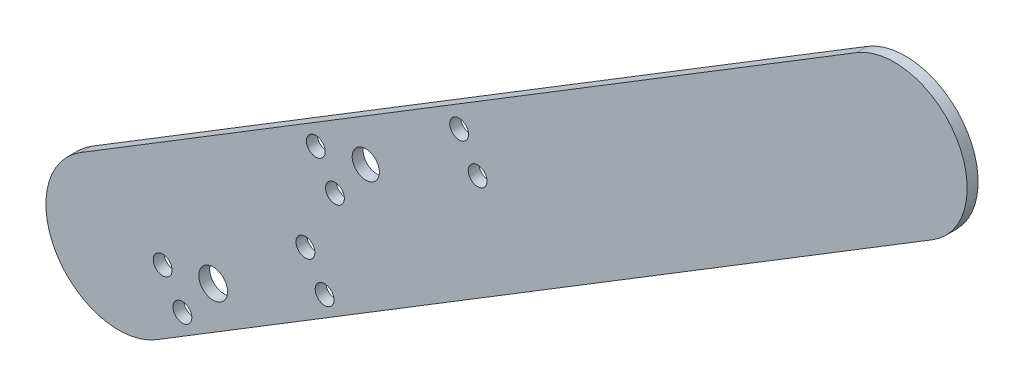
from build123d import *

# Parameters (mm, degrees)
BASE_FLANGE3_DEPTH         = 3
SKETCH2_R                  = 3.731705756
CUT_EXTRUDE1_DEPTH         = 10
F_6_0_204_DIAMETER_SLOT2_D = 5.1816
F_6_0_204_DIAMETER_SLOT3_D = 5.1816
F_6_0_204_DIAMETER_SLOT4_D = 5.1816
SKETCH11_R                 = 3.962302528
CUT_EXTRUDE2_DEPTH         = 10


# Sheet-metal steps are written as plain solids
with BuildPart() as part:
    # Sketch1 → Base-Flange3 (new body)
    with BuildSketch(Plane.XY):
        with BuildLine():
            Line((-47.22804279, 44.626403811), (166.055568315, 175.049182627))
            ThreePointArc((166.055568315, 175.049182627), (193.552079509, 168.420316044), (186.923212926, 140.923804851))
            Line((186.923212926, 140.923804851), (-26.360398179, 10.501026034))
            ThreePointArc((-26.360398179, 10.501026034), (-53.856909373, 17.129892617), (-47.22804279, 44.626403811))
        make_face()
    extrude(amount=-BASE_FLANGE3_DEPTH)

    # Sketch2 → Cut-Extrude1 (cut)
    with BuildSketch(Plane.XY):
        with Locations((31.145480049, 80.970292312)):
            Circle(SKETCH2_R)
    extrude(amount=-CUT_EXTRUDE1_DEPTH, mode=Mode.SUBTRACT)

    # #6 (0.204) Diameter Slot2 (through all)
    with Locations(Plane(origin=(0, 0, -3), x_dir=(-1, 0, 0), z_dir=(0, 0, -1))):
        with Locations((-17.407880198, 78.439004647), (-22.671102144, 69.904673863)):
            Hole(F_6_0_204_DIAMETER_SLOT2_D / 2)

    # #6 (0.204) Diameter Slot3 (through all)
    with Locations(Plane(origin=(0, 0, -3), x_dir=(-1, 0, 0), z_dir=(0, 0, -1))):
        with Locations((-56.818082529, 102.219704658), (-61.899947849, 93.651215053)):
            Hole(F_6_0_204_DIAMETER_SLOT3_D / 2)

    # #6 (0.204) Diameter Slot4 (through all)
    with Locations(Plane.XY):
        with Locations((19.820589148, 44.323153185), (14.559362277, 52.969376644), (-19.270561455, 20.579982386), (-24.692774151, 29.137979438)):
            Hole(F_6_0_204_DIAMETER_SLOT4_D / 2)

    # Sketch11 → Cut-Extrude2 (cut)
    with BuildSketch(Plane(origin=(0, 0, -3), x_dir=(-1, 0, 0), z_dir=(0, 0, -1))):
        with Locations((10.804804657, 31.636368095)):
            Circle(SKETCH11_R)
    extrude(amount=-CUT_EXTRUDE2_DEPTH, mode=Mode.SUBTRACT)


solid = part.part
